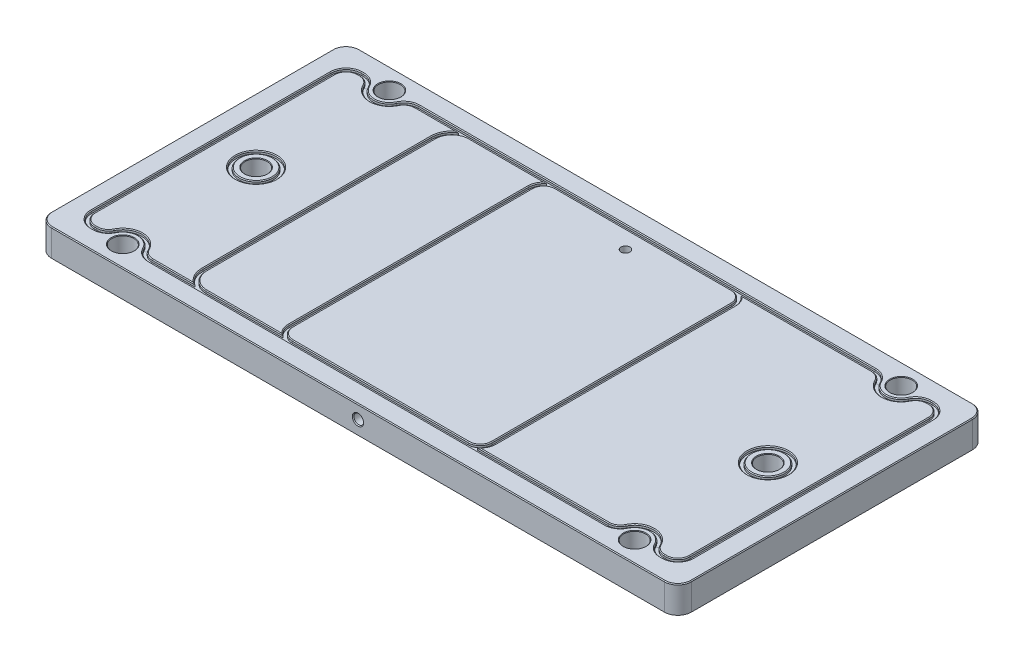
from build123d import *

# Parameters (mm, degrees)
SKETCH1_W                                        = 600.075
SKETCH1_H                                        = 288.925
BOSS_EXTRUDE1_DEPTH                              = 25.4
CBORE_FOR_1_2_SOCKET_HEAD_CAP_SCREW1_D           = 13.49248
CBORE_FOR_1_2_SOCKET_HEAD_CAP_SCREW1_CBORE_D     = 20.6375
CBORE_FOR_1_2_SOCKET_HEAD_CAP_SCREW1_CBORE_DEPTH = 17.78
CHAMFER1_SIZE                                    = 0.508
CORNER_ROUND_OVER_R                              = 12.7
OUTSIDE_EDGE_CHAMF_SIZE                          = 0.762
PROFILE_W                                        = 3
PROFILE_H                                        = 5.08
BIG_GROOVE_CHAMF_SIZE                            = 0.762
SKETCH19_R                                       = 18.875
SKETCH19_R_2                                     = 15.875
SMALL_GROOVE_DEPTH                               = 2.54
SM_GROOVE_CHAMF_SIZE                             = 0.762
F_1_8_27_NPSM_TAPPED_HOLE2_D                     = 9.0932
F_1_8_27_NPSM_TAPPED_HOLE2_DEPTH                 = 50.8
F_1_8_27_NPSM_TAPPED_HOLE2_TIP                   = 2.73187289
F_21_64_0_32813_DIAMETER_HOLE1_D                 = 8.334502
F_21_64_0_32813_DIAMETER_HOLE1_DEPTH             = 12.7
F_21_64_0_32813_DIAMETER_HOLE1_TIP               = 2.503937016
SM_GROOVE_CHAMF_OF_SM_GROOVE_MIRROR_SIZE         = 0.762
PROFILE_2_W                                      = 3
PROFILE_2_H                                      = 5.08
CHAMFER6_SIZE                                    = 0.762
GROOVE_PROFILE_W                                 = 3
GROOVE_PROFILE_H                                 = 5.08
CHAMFER7_SIZE                                    = 0.762
BOTTOM_SLOT_PROFILE_W                            = 3
BOTTOM_SLOT_PROFILE_H                            = 5.08
CHAMFER8_SIZE                                    = 0.762
F_1_4_20_TAPPED_HOLE1_D                          = 5.1054
F_1_4_20_TAPPED_HOLE1_DEPTH                      = 12.7
F_1_4_20_TAPPED_HOLE1_TIP                        = 1.533816902
CHAMFER9_SIZE                                    = 0.762
BOTTOM_SLOT_PROFILE2_W                           = 3
BOTTOM_SLOT_PROFILE2_H                           = 5.08
CHAMFER10_SIZE                                   = 0.762
F_1_8_27_NPSM_TAPPED_HOLE3_D                     = 9.0932
F_1_8_27_NPSM_TAPPED_HOLE3_DEPTH                 = 50.8
F_1_8_27_NPSM_TAPPED_HOLE3_TIP                   = 2.73187289
F_1_4_20_TAPPED_HOLE2_D                          = 5.1054
F_1_4_20_TAPPED_HOLE2_DEPTH                      = 12.7
F_1_4_20_TAPPED_HOLE2_TIP                        = 1.533816902
CHAMFER11_SIZE                                   = 0.762
FILLET2_R                                        = 1.190625


with BuildPart() as part:
    # Sketch1 → Boss-Extrude1 (new body)
    with BuildSketch(Plane(origin=(0, 0, 0), x_dir=(1, 0, 0), z_dir=(0, 1, 0))):
        Rectangle(SKETCH1_W, SKETCH1_H)
    extrude(amount=BOSS_EXTRUDE1_DEPTH)

    # CBORE for 1/2 Socket Head Cap Screw1 (through all)
    with Locations(Plane(origin=(0, 25.4, 0), x_dir=(1, 0, 0), z_dir=(0, 1, 0))):
        with Locations((-240, 125), (-240, 0), (240, 125), (240, 0), (240, -125), (-240, -125)):
            CounterBoreHole(CBORE_FOR_1_2_SOCKET_HEAD_CAP_SCREW1_D / 2, CBORE_FOR_1_2_SOCKET_HEAD_CAP_SCREW1_CBORE_D / 2, CBORE_FOR_1_2_SOCKET_HEAD_CAP_SCREW1_CBORE_DEPTH)

    # Chamfer1
    chamfer1_edges = [part.edges().sort_by_distance(p)[0] for p in [
        (-250.31875, 25.4, 125),
        (229.68125, 25.4, 125),
        (229.68125, 25.4, 0),
        (229.68125, 25.4, -125),
        (-250.31875, 25.4, 0),
        (-250.31875, 25.4, -125),
    ]]
    chamfer(chamfer1_edges, length=CHAMFER1_SIZE)

    # Corner_Round_Over
    corner_round_over_edges = [part.edges().sort_by_distance(p)[0] for p in [
        (300.0375, 12.7, 144.4625),
        (-300.0375, 12.7, 144.4625),
        (-300.0375, 12.7, -144.4625),
        (300.0375, 12.7, -144.4625),
    ]]
    fillet(corner_round_over_edges, radius=CORNER_ROUND_OVER_R)

    # Outside_Edge_Chamf
    outside_edge_chamf_edges = [part.edges().sort_by_distance(p)[0] for p in [
        (0, 25.4, 144.4625),
        (0, 25.4, -144.4625),
        (-300.0375, 25.4, 0),
        (-296.317756121, 25.4, -140.742756121),
        (296.317756121, 25.4, -140.742756121),
        (-296.317756121, 25.4, 140.742756121),
        (296.317756121, 25.4, 140.742756121),
        (300.0375, 25.4, 0),
    ]]
    chamfer(outside_edge_chamf_edges, length=OUTSIDE_EDGE_CHAMF_SIZE)

    # Big Groove: sweep along a path in Path
    with BuildLine(Plane(origin=(0, 25.4, 0), x_dir=(1, 0, 0), z_dir=(0, 1, 0))) as big_groove_path:
        Line((-213.976122021, 125), (213.976122021, 125))
        ThreePointArc((213.976122021, 125), (220.704875363, 123.070973886), (225.389543523, 117.869902118))
        ThreePointArc((225.389543523, 117.869902118), (240, 108.742579102), (254.610456477, 117.869902118))
        ThreePointArc((254.610456477, 117.869902118), (259.295124637, 123.070973886), (266.023877979, 125))
        Line((266.023877979, 125), (267.875, 125))
        ThreePointArc((267.875, 125), (276.855256121, 121.280256121), (280.575, 112.3))
        Line((280.575, 112.3), (280.575, -112.3))
        ThreePointArc((280.575, -112.3), (276.855256121, -121.280256121), (267.875, -125))
        Line((267.875, -125), (266.023877979, -125))
        ThreePointArc((266.023877979, -125), (259.295124637, -123.070973886), (254.610456477, -117.869902118))
        ThreePointArc((254.610456477, -117.869902118), (240, -108.742579102), (225.389543523, -117.869902118))
        ThreePointArc((225.389543523, -117.869902118), (220.704875363, -123.070973886), (213.976122021, -125))
        Line((213.976122021, -125), (-213.976122021, -125))
        ThreePointArc((-213.976122021, -125), (-220.704875363, -123.070973886), (-225.389543523, -117.869902118))
        ThreePointArc((-225.389543523, -117.869902118), (-240, -108.742579102), (-254.610456477, -117.869902118))
        ThreePointArc((-254.610456477, -117.869902118), (-259.295124637, -123.070973886), (-266.023877979, -125))
        Line((-266.023877979, -125), (-267.875, -125))
        ThreePointArc((-267.875, -125), (-276.855256121, -121.280256121), (-280.575, -112.3))
        Line((-280.575, -112.3), (-280.575, 112.3))
        ThreePointArc((-280.575, 112.3), (-276.855256121, 121.280256121), (-267.875, 125))
        Line((-267.875, 125), (-266.023877979, 125))
        ThreePointArc((-266.023877979, 125), (-259.295124637, 123.070973886), (-254.610456477, 117.869902118))
        ThreePointArc((-254.610456477, 117.869902118), (-240, 108.742579102), (-225.389543523, 117.869902118))
        ThreePointArc((-225.389543523, 117.869902118), (-220.704875363, 123.070973886), (-213.976122021, 125))
    # Profile → Big Groove (sweep, cut)
    with BuildSketch(Plane.XY):
        with Locations((-280.575, 25.4)):
            Rectangle(PROFILE_W, PROFILE_H)
    sweep(path=big_groove_path.line, mode=Mode.SUBTRACT)

    # Big_Groove_Chamf
    big_groove_chamf_edges = [part.edges().sort_by_distance(p)[0] for p in [
        (-282.075, 25.4, 0),
        (-277.915916293, 25.4, 122.340916293),
        (-266.94943899, 25.4, 126.5),
        (-258.50038999, 25.4, 124.343136156),
        (-240, 25.4, 110.242579102),
        (-221.49961001, 25.4, 124.343136156),
        (0, 25.4, 126.5),
        (221.49961001, 25.4, 124.343136156),
        (240, 25.4, 110.242579102),
        (258.50038999, 25.4, 124.343136156),
        (266.94943899, 25.4, 126.5),
        (277.915916293, 25.4, 122.340916293),
        (282.075, 25.4, 0),
        (277.915916293, 25.4, -122.340916293),
        (266.94943899, 25.4, -126.5),
        (258.50038999, 25.4, -124.343136156),
        (240, 25.4, -110.242579102),
        (221.49961001, 25.4, -124.343136156),
        (0, 25.4, -126.5),
        (-221.49961001, 25.4, -124.343136156),
        (-240, 25.4, -110.242579102),
        (-258.50038999, 25.4, -124.343136156),
        (-266.94943899, 25.4, -126.5),
        (-277.915916293, 25.4, -122.340916293),
        (-282.075, 25.4, 0),
        (-275.794595949, 25.4, 120.219595949),
        (-266.94943899, 25.4, 123.5),
        (-260.089859283, 25.4, 121.798811616),
        (-240, 25.4, 107.242579102),
        (-219.910140717, 25.4, 121.798811616),
        (0, 25.4, 123.5),
        (219.910140717, 25.4, 121.798811616),
        (240, 25.4, 107.242579102),
        (260.089859283, 25.4, 121.798811616),
        (266.94943899, 25.4, 123.5),
        (275.794595949, 25.4, 120.219595949),
        (279.075, 25.4, 0),
        (275.794595949, 25.4, -120.219595949),
        (266.94943899, 25.4, -123.5),
        (260.089859283, 25.4, -121.798811616),
        (240, 25.4, -107.242579102),
        (219.910140717, 25.4, -121.798811616),
        (0, 25.4, -123.5),
        (-219.910140717, 25.4, -121.798811616),
        (-240, 25.4, -107.242579102),
        (-260.089859283, 25.4, -121.798811616),
        (-266.94943899, 25.4, -123.5),
        (-275.794595949, 25.4, -120.219595949),
        (-279.075, 25.4, 0),
        (-279.075, 25.4, 0),
    ]]
    chamfer(big_groove_chamf_edges, length=BIG_GROOVE_CHAMF_SIZE)

    # Sketch19 → Small_Groove (cut)
    with BuildSketch(Plane(origin=(0, 25.4, 0), x_dir=(1, 0, 0), z_dir=(0, 1, 0))):
        with Locations(Location((-240, 0, 0), (0, 0, 270))):
            Circle(SKETCH19_R)
        with Locations(Location((-240, 0, 0), (0, 0, 270))):
            Circle(SKETCH19_R_2, mode=Mode.SUBTRACT)
    small_groove = extrude(amount=-SMALL_GROOVE_DEPTH, mode=Mode.SUBTRACT)

    # Sm_Groove_Chamf
    sm_groove_chamf_edges = [part.edges().sort_by_distance(p)[0] for p in [
        (-240, 25.4, -18.875),
        (-240, 25.4, -15.875),
    ]]
    chamfer(sm_groove_chamf_edges, length=SM_GROOVE_CHAMF_SIZE)

    # 1/8-27 NPSM Tapped Hole2
    with Locations(Plane(origin=(0, 0, -144.4625), x_dir=(-1, 0, 0), z_dir=(0, 0, -1))):
        with Locations((0, 12.7)):
            Hole(F_1_8_27_NPSM_TAPPED_HOLE2_D / 2, depth=F_1_8_27_NPSM_TAPPED_HOLE2_DEPTH)
            with Locations((0, 0, -(F_1_8_27_NPSM_TAPPED_HOLE2_DEPTH + F_1_8_27_NPSM_TAPPED_HOLE2_TIP / 2))):  # 118° drill point
                Cone(0, F_1_8_27_NPSM_TAPPED_HOLE2_D / 2, F_1_8_27_NPSM_TAPPED_HOLE2_TIP, mode=Mode.SUBTRACT)

    # 21/64 (0.32813) Diameter Hole1
    with Locations(Plane(origin=(0, 25.4, 0), x_dir=(1, 0, 0), z_dir=(0, 1, 0))):
        with Locations((0, 106.3625)):
            Hole(F_21_64_0_32813_DIAMETER_HOLE1_D / 2, depth=F_21_64_0_32813_DIAMETER_HOLE1_DEPTH)
            with Locations((0, 0, -(F_21_64_0_32813_DIAMETER_HOLE1_DEPTH + F_21_64_0_32813_DIAMETER_HOLE1_TIP / 2))):  # 118° drill point
                Cone(0, F_21_64_0_32813_DIAMETER_HOLE1_D / 2, F_21_64_0_32813_DIAMETER_HOLE1_TIP, mode=Mode.SUBTRACT)

    # Sm_Groove_Mirror: Small_Groove across plane
    add(small_groove.mirror(Plane.ZY), mode=Mode.SUBTRACT)

    # Sm_Groove_Chamf of Sm_Groove_Mirror
    sm_groove_chamf_of_sm_groove_mirror_edges = [part.edges().sort_by_distance(p)[0] for p in [
        (240, 25.4, -18.875),
        (240, 25.4, -15.875),
    ]]
    chamfer(sm_groove_chamf_of_sm_groove_mirror_edges, length=SM_GROOVE_CHAMF_OF_SM_GROOVE_MIRROR_SIZE)

    # Sub_Groove: sweep along a path in Path-2
    with BuildLine(Plane(origin=(0, 25.4, 0), x_dir=(1, 0, 0), z_dir=(0, 1, 0))) as sub_groove_path:
        Line((-141.2875, 125), (-163.5125, 125))
        ThreePointArc((-163.5125, 125), (-176.084858569, 119.792358569), (-181.2925, 107.22))
        Line((-181.2925, 107.22), (-181.2925, -107.22))
        ThreePointArc((-181.2925, -107.22), (-176.084858569, -119.792358569), (-163.5125, -125))
        Line((-163.5125, -125), (-141.2875, -125))
    # Profile_2 → Sub_Groove (sweep, cut)
    with BuildSketch(Plane.ZY.offset(141.2875)):
        with Locations((-125, 25.4)):
            Rectangle(PROFILE_2_W, PROFILE_2_H)
    sweep(path=sub_groove_path.line, mode=Mode.SUBTRACT)

    # Chamfer6
    chamfer6_edges = [part.edges().sort_by_distance(p)[0] for p in [
        (-176.649759259, 25.4, -116.8351349),
        (-179.7925, 25.4, 0),
        (-176.649759259, 25.4, 116.8351349),
        (-180.721688456, 25.4, -115.91265395),
        (-182.7925, 25.4, 0),
        (-180.721688456, 25.4, 115.91265395),
    ]]
    chamfer(chamfer6_edges, length=CHAMFER6_SIZE - 0.0001)  # a hair under: the kernel refuses the full size

    # Cut-Sweep1: sweep along a path in Groove_Path
    with BuildLine(Plane(origin=(0, 25.4, 0), x_dir=(1, 0, 0), z_dir=(0, 1, 0))) as cut_sweep1_path:
        Line((82.55, 125), (-82.55, 125))
        ThreePointArc((-82.55, 125), (-91.530256121, 121.280256121), (-95.25, 112.3))
        Line((-95.25, 112.3), (-95.25, -112.3))
        ThreePointArc((-95.25, -112.3), (-91.530256121, -121.280256121), (-82.55, -125))
        Line((-82.55, -125), (82.55, -125))
        ThreePointArc((82.55, -125), (91.530256121, -121.280256121), (95.25, -112.3))
        Line((95.25, -112.3), (95.25, 112.3))
        ThreePointArc((95.25, 112.3), (91.530256121, 121.280256121), (82.55, 125))
    # Groove_Profile → Cut-Sweep1 (sweep, cut)
    with BuildSketch(Plane.ZY.offset(71.4375)):
        with Locations((-125, 25.4)):
            Rectangle(GROOVE_PROFILE_W, GROOVE_PROFILE_H)
    sweep(path=cut_sweep1_path.line, mode=Mode.SUBTRACT)

    # Chamfer7
    chamfer7_edges = [part.edges().sort_by_distance(p)[0] for p in [
        (95.55673013, 25.4, 117.99780408),
        (95.55673013, 25.4, -117.99780408),
        (96.75, 25.4, 0),
        (-95.55673013, 25.4, -117.99780408),
        (-95.55673013, 25.4, 117.99780408),
        (-96.75, 25.4, 0),
        (-91.794411385, 25.4, 118.623041843),
        (-91.794411385, 25.4, -118.623041843),
        (-93.75, 25.4, 0),
        (91.794411385, 25.4, -118.623041843),
        (91.794411385, 25.4, 118.623041843),
        (93.75, 25.4, 0),
    ]]
    chamfer(chamfer7_edges, length=CHAMFER7_SIZE - 0.0001)  # a hair under: the kernel refuses the full size

    # Bottom_Groove_Front: sweep along a path in Bottom_Slot_Path
    with BuildLine(Plane.XZ) as bottom_groove_front_path:
        Line((-260.35, -100.6), (260.35, -100.6))
        ThreePointArc((260.35, -100.6), (269.330256121, -96.880256121), (273.05, -87.9))
        Line((273.05, -87.9), (273.05, -37.1))
        ThreePointArc((273.05, -37.1), (269.330256121, -28.119743879), (260.35, -24.4))
        Line((260.35, -24.4), (-260.35, -24.4))
        ThreePointArc((-260.35, -24.4), (-269.330256121, -28.119743879), (-273.05, -37.1))
        Line((-273.05, -37.1), (-273.05, -87.9))
        ThreePointArc((-273.05, -87.9), (-269.330256121, -96.880256121), (-260.35, -100.6))
    # Bottom_Slot_Profile → Bottom_Groove_Front (sweep, cut)
    with BuildSketch(Plane.ZY.offset(141.2875)):
        with Locations((-100.6, 0)):
            Rectangle(BOTTOM_SLOT_PROFILE_W, BOTTOM_SLOT_PROFILE_H)
    sweep(path=bottom_groove_front_path.line, mode=Mode.SUBTRACT)

    # Chamfer8
    chamfer8_edges = [part.edges().sort_by_distance(p)[0] for p in [
        (0, 0, -102.1),
        (-270.390916293, 0, -97.940916293),
        (-274.55, 0, -62.5),
        (-270.390916293, 0, -27.059083707),
        (0, 0, -22.9),
        (270.390916293, 0, -27.059083707),
        (274.55, 0, -62.5),
        (270.390916293, 0, -97.940916293),
        (0, 0, -102.1),
        (-268.269595949, 0, -95.819595949),
        (-271.55, 0, -62.5),
        (-268.269595949, 0, -29.180404051),
        (0, 0, -25.9),
        (268.269595949, 0, -29.180404051),
        (271.55, 0, -62.5),
        (268.269595949, 0, -95.819595949),
        (0, 0, -99.1),
        (0, 0, -99.1),
    ]]
    chamfer(chamfer8_edges, length=CHAMFER8_SIZE)

    # 1/4-20 Tapped Hole1
    with Locations(Plane(origin=(0, 0, 0), x_dir=(-1, 0, 0), z_dir=(0, -1, 0))):
        with Locations((0, 90.4875)):
            Hole(F_1_4_20_TAPPED_HOLE1_D / 2, depth=F_1_4_20_TAPPED_HOLE1_DEPTH)
            with Locations((0, 0, -(F_1_4_20_TAPPED_HOLE1_DEPTH + F_1_4_20_TAPPED_HOLE1_TIP / 2))):  # 118° drill point
                Cone(0, F_1_4_20_TAPPED_HOLE1_D / 2, F_1_4_20_TAPPED_HOLE1_TIP, mode=Mode.SUBTRACT)

    # Chamfer9
    chamfer9_edges = [part.edges().sort_by_distance(p)[0] for p in [
        (-2.5527, 0, -90.4875),
    ]]
    chamfer(chamfer9_edges, length=CHAMFER9_SIZE)

    # Cut-Sweep3: sweep along a path in Bottom_Slot_Path2
    with BuildLine(Plane.XZ) as cut_sweep3_path:
        Line((-260.35, 24.4), (260.35, 24.4))
        ThreePointArc((260.35, 24.4), (269.330256121, 28.119743879), (273.05, 37.1))
        Line((273.05, 37.1), (273.05, 87.9))
        ThreePointArc((273.05, 87.9), (269.330256121, 96.880256121), (260.35, 100.6))
        Line((260.35, 100.6), (-260.35, 100.6))
        ThreePointArc((-260.35, 100.6), (-269.330256121, 96.880256121), (-273.05, 87.9))
        Line((-273.05, 87.9), (-273.05, 37.1))
        ThreePointArc((-273.05, 37.1), (-269.330256121, 28.119743879), (-260.35, 24.4))
    # Bottom_Slot_Profile2 → Cut-Sweep3 (sweep, cut)
    with BuildSketch(Plane.ZY.offset(71.4375)):
        with Locations((24.4, 0)):
            Rectangle(BOTTOM_SLOT_PROFILE2_W, BOTTOM_SLOT_PROFILE2_H)
    sweep(path=cut_sweep3_path.line, mode=Mode.SUBTRACT)

    # Chamfer10
    chamfer10_edges = [part.edges().sort_by_distance(p)[0] for p in [
        (0, 0, 22.9),
        (-270.390916293, 0, 27.059083707),
        (-274.55, 0, 62.5),
        (-270.390916293, 0, 97.940916293),
        (0, 0, 102.1),
        (270.390916293, 0, 97.940916293),
        (274.55, 0, 62.5),
        (270.390916293, 0, 27.059083707),
        (0, 0, 22.9),
        (-268.269595949, 0, 29.180404051),
        (-271.55, 0, 62.5),
        (-268.269595949, 0, 95.819595949),
        (0, 0, 99.1),
        (268.269595949, 0, 95.819595949),
        (271.55, 0, 62.5),
        (268.269595949, 0, 29.180404051),
        (0, 0, 25.9),
        (0, 0, 25.9),
    ]]
    chamfer(chamfer10_edges, length=CHAMFER10_SIZE)

    # 1/8-27 NPSM Tapped Hole3
    with Locations(Plane.XY.offset(144.4625)):
        with Locations((0, 12.7)):
            Hole(F_1_8_27_NPSM_TAPPED_HOLE3_D / 2, depth=F_1_8_27_NPSM_TAPPED_HOLE3_DEPTH)
            with Locations((0, 0, -(F_1_8_27_NPSM_TAPPED_HOLE3_DEPTH + F_1_8_27_NPSM_TAPPED_HOLE3_TIP / 2))):  # 118° drill point
                Cone(0, F_1_8_27_NPSM_TAPPED_HOLE3_D / 2, F_1_8_27_NPSM_TAPPED_HOLE3_TIP, mode=Mode.SUBTRACT)

    # 1/4-20 Tapped Hole2
    with Locations(Plane(origin=(0, 0, 0), x_dir=(-1, 0, 0), z_dir=(0, -1, 0))):
        with Locations((0, -90.4875)):
            Hole(F_1_4_20_TAPPED_HOLE2_D / 2, depth=F_1_4_20_TAPPED_HOLE2_DEPTH)
            with Locations((0, 0, -(F_1_4_20_TAPPED_HOLE2_DEPTH + F_1_4_20_TAPPED_HOLE2_TIP / 2))):  # 118° drill point
                Cone(0, F_1_4_20_TAPPED_HOLE2_D / 2, F_1_4_20_TAPPED_HOLE2_TIP, mode=Mode.SUBTRACT)

    # Chamfer11
    chamfer11_edges = [part.edges().sort_by_distance(p)[0] for p in [
        (4.5466, 12.7, 144.4625),
        (-2.5527, 0, 90.4875),
        (-4.5466, 12.7, -144.4625),
    ]]
    chamfer(chamfer11_edges, length=CHAMFER11_SIZE)

    # Fillet2
    fillet2_edges = [part.edges().sort_by_distance(p)[0] for p in [
        (0, 2.54, 25.9),
        (0, 2.54, 22.9),
        (268.269595949, 2.54, 29.180404051),
        (270.390916293, 2.54, 27.059083707),
        (271.55, 2.54, 62.5),
        (274.55, 2.54, 62.5),
        (268.269595949, 2.54, 95.819595949),
        (270.390916293, 2.54, 97.940916293),
        (0, 2.54, 99.1),
        (0, 2.54, 102.1),
        (-268.269595949, 2.54, 95.819595949),
        (-270.390916293, 2.54, 97.940916293),
        (-271.55, 2.54, 62.5),
        (-274.55, 2.54, 62.5),
        (-268.269595949, 2.54, 29.180404051),
        (-270.390916293, 2.54, 27.059083707),
        (0, 2.54, 25.9),
        (0, 2.54, 22.9),
    ]]
    fillet(fillet2_edges, radius=FILLET2_R)


solid = part.part
